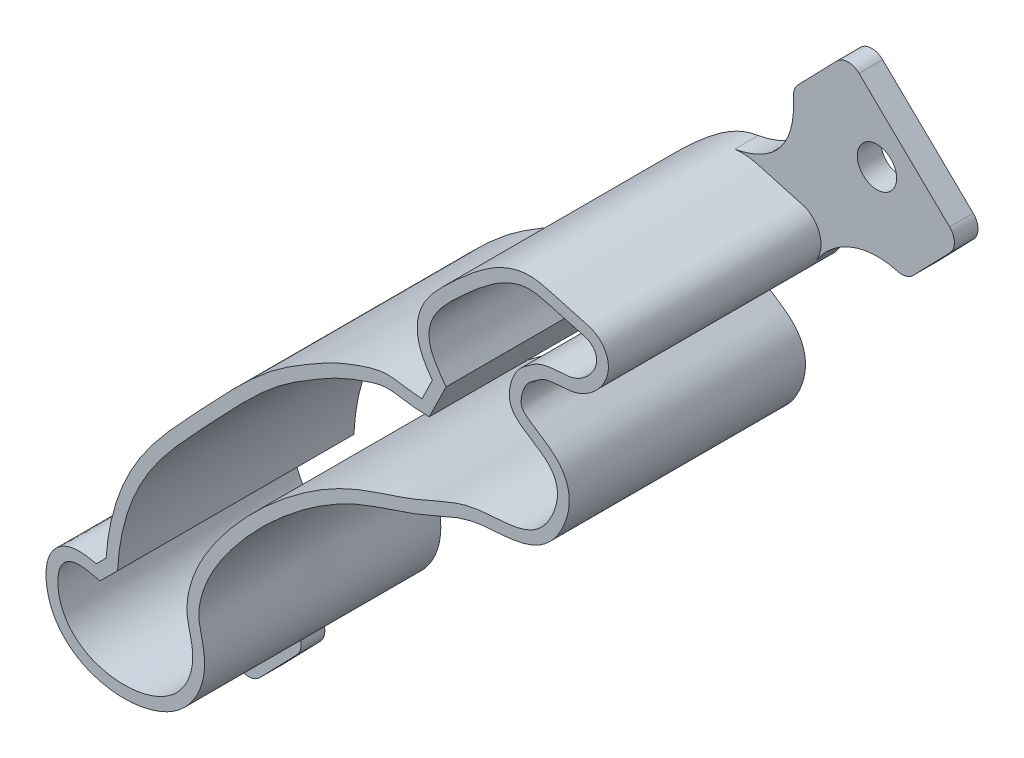
from build123d import *

# Parameters (mm, degrees)
AUFSATZ_LINEAR_AUSTRAGEN1_DEPTH = 30
SKIZZE4_R                       = 2.5
AUFSATZ_LINEAR_AUSTRAGEN2_DEPTH = 3
VERRUNDUNG2_R                   = 2


with BuildPart() as part:
    # Skizze1 → Aufsatz-Linear austragen1 (new body)
    with BuildSketch(Plane.XY):
        with BuildLine():
            Line((42.684745175, 107.096993324), (41.368199668, 104.408447166))
            add(Edge.make_bspline(
                [(41.368199668, 104.408447166), (41.110444786, 104.420789515), (40.571909189, 104.459226297), (39.686790245, 104.558252616), (38.839336683, 104.696831836), (37.785412304, 104.87433639), (36.403984322, 104.903282846), (34.890938306, 104.578423384), (33.494701301, 104.108622874), (32.300077498, 103.674851105), (30.87069998, 103.094466137), (29.377511181, 102.385227444), (27.924342025, 101.572360027), (26.668213716, 100.837909596), (24.921268561, 99.788883681), (22.676632693, 98.298620113), (19.753153503, 95.853589631), (16.756521908, 92.861675129), (13.870308283, 89.797541938), (11.280500902, 87.06101569), (8.925574014, 84.474859509), (6.828379984, 81.916464665), (5.011414663, 79.235661473), (3.538385102, 76.416346451), (2.599357566, 73.941292572), (2.02372332, 71.877642735), (1.679434335, 70.294523949), (1.462133561, 68.912253102), (1.330509691, 67.749644023), (1.277236276, 67.130335663), (1.254730167, 66.824976337)],
                knots=[0.067302069, 0.067302069, 0.067302069, 0.067302069, 0.069464425, 0.071626781, 0.075951494, 0.080276206, 0.084600918, 0.088925631, 0.093250343, 0.097575055, 0.101899768, 0.110549192, 0.119198617, 0.127848042, 0.136497466, 0.153796315, 0.171095165, 0.188394014, 0.205692863, 0.222991712, 0.240290562, 0.257589411, 0.27488826, 0.292187109, 0.309485959, 0.318135383, 0.326784808, 0.335434233, 0.339758945, 0.344083657, 0.344083657, 0.344083657, 0.344083657], degree=3))
            Line((1.254730167, 66.824976337), (0.017796089, 65.588042258))
            add(Edge.make_bspline(
                [(0.017796089, 65.588042258), (-0.244648213, 65.64806781), (-0.755191613, 65.756926814), (-1.629856798, 65.882438741), (-2.614690737, 65.902488558), (-3.603844624, 65.718346383), (-4.469780461, 65.294320663), (-5.265117391, 64.663740553), (-5.882578719, 63.748387396), (-6.239582178, 62.694571707), (-6.424489488, 61.374304763), (-6.320306972, 59.821598642), (-5.838699384, 58.064670176), (-5.017650332, 56.520278156), (-3.928053668, 55.233811575), (-2.649995065, 54.221218877), (-0.784150663, 53.215725841), (1.728758627, 52.536954876), (4.808293622, 52.484198335), (7.773624977, 53.126623931), (10.504152088, 54.533839182), (12.559787893, 56.785829512), (13.480238502, 58.991878403), (13.779666355, 60.83173084), (13.751039061, 62.738900333), (13.371743296, 64.239268886), (13.117064427, 65.391493969), (13.028347287, 66.036020364), (13.023518574, 66.721100206), (13.121598696, 67.704660197), (13.438509749, 69.034808789), (14.028892738, 70.62728641), (14.785894011, 72.16323496), (15.704866368, 73.686138517), (17.126331547, 75.727266174), (19.166063123, 78.234748399), (22.84359805, 82.012108664), (26.914890769, 85.268263257), (30.928485532, 87.698918859), (33.719631565, 88.991220721), (36.531413695, 89.965738513), (39.074183345, 90.7912503), (41.257237752, 91.598971181), (43.006447006, 92.349575342), (44.654504426, 93.112093696), (46.319465893, 93.766075323), (47.836974638, 94.170038313), (49.156753082, 94.367726158), (50.329679031, 94.449710982), (51.730768055, 94.532641699), (53.268067895, 94.70413148), (54.918338671, 95.09694813), (56.633188858, 95.884386862), (58.185300186, 97.322226028), (59.151259534, 98.903343484), (59.784278271, 100.47929905), (60.115229864, 102.014685415), (60.05302807, 103.66672864), (59.441536213, 105.22509509), (58.476947683, 106.416553856), (57.368278048, 107.310038504), (56.304452671, 108.001807994), (55.019721335, 108.808125922), (54.347004291, 109.379941438), (54.094317117, 109.753332202), (54.008173476, 109.964363478), (53.953029789, 110.24776581), (53.971305456, 110.787494722), (54.106436457, 111.450340423), (54.342775551, 112.099160299), (54.598074263, 112.561241013), (54.869658734, 112.89201557), (55.231700609, 113.226311081), (55.697591488, 113.571495459), (56.23748954, 113.949900249), (56.560624546, 114.146654628), (56.843540157, 114.278418914), (57.187335435, 114.386143729), (57.60447607, 114.470585282), (57.999278293, 114.528685861), (58.401125805, 114.569955012), (58.776462947, 114.597357517), (59.068514562, 114.614447581), (59.441900862, 114.629359852), (59.977725276, 114.668739075), (60.622397089, 114.76745089), (61.390581121, 114.99205063), (62.105336096, 115.334077904), (62.938449707, 115.872746083), (63.827596145, 116.690707986), (64.536292789, 117.700102022), (64.940057116, 118.741621438), (65.092514319, 119.705306675), (64.928404483, 120.881660275), (64.246562877, 122.029666883), (63.256137541, 122.774829518), (62.202024178, 123.115493857), (61.802040186, 123.194059258), (61.41431502, 123.29737748), (61.047982241, 123.394160641), (60.539356847, 123.535818691), (59.957270455, 123.702322368), (59.220811129, 123.910609773), (58.57483209, 124.090877152), (57.934449819, 124.26525543), (57.366827181, 124.419678095), (56.638996122, 124.605724945), (55.708700262, 124.781939863), (54.580399979, 124.781955193), (53.519531216, 124.645437169), (52.280840664, 124.284255555), (50.483658808, 123.442733168), (48.487135329, 122.076217429), (46.397465294, 120.283391136), (44.65504561, 118.698758406), (43.096740441, 117.149873286), (41.798273751, 115.510572973), (40.84344516, 113.539688645), (40.683235015, 111.544530592), (41.046321185, 109.993839809), (41.525042222, 108.894111465), (42.092878422, 107.945562788), (42.482020559, 107.381105246), (42.684745175, 107.096993324)],
                knots=[0.379779857, 0.379779857, 0.379779857, 0.379779857, 0.382366781, 0.384953706, 0.387540631, 0.390127555, 0.391421018, 0.39271448, 0.395301405, 0.397888329, 0.400475254, 0.405649103, 0.410822953, 0.415996802, 0.421170651, 0.426344501, 0.43151835, 0.441866049, 0.452213747, 0.462561446, 0.472909145, 0.483256843, 0.493604542, 0.498778391, 0.503952241, 0.51429994, 0.519473789, 0.524647638, 0.529821488, 0.534995337, 0.545343036, 0.555690734, 0.566038433, 0.576386132, 0.58673383, 0.607429228, 0.628124625, 0.66951542, 0.690210817, 0.710906215, 0.731601612, 0.752297009, 0.762644708, 0.772992407, 0.783340105, 0.793687804, 0.804035503, 0.809209352, 0.814383201, 0.819557051, 0.8247309, 0.829904749, 0.835078599, 0.840252448, 0.845426297, 0.850600147, 0.855773996, 0.860947845, 0.866121695, 0.871295544, 0.876469394, 0.881643243, 0.886817092, 0.897164791, 0.90233864, 0.90751249, 0.912686339, 0.917860188, 0.923034038, 0.928207887, 0.933381736, 0.938555586, 0.943729435, 0.948903284, 0.954077134, 0.959250983, 0.964424832, 0.969598682, 0.972185606, 0.974772531, 0.977359456, 0.978652918, 0.97994638, 0.981239843, 0.982533305, 0.983826767, 0.98512023, 0.986413692, 0.987707154, 0.990294079, 0.992881004, 0.994174466, 0.995467928, 0.996761391, 0.998054853, 0.999348315, 1.000641778, 1.00193524, 1.003228702, 1.004522165, 1.005815627, 1.008402552, 1.009696014, 1.010989476, 1.012282939, 1.01292967, 1.013576401, 1.014869863, 1.015516595, 1.016163326, 1.017456788, 1.01875025, 1.021337175, 1.0239241, 1.026511024, 1.029097949, 1.031684874, 1.034271798, 1.036858723, 1.038152185, 1.039445648, 1.04073911, 1.042032572, 1.042032572, 1.042032572, 1.042032572], degree=3))
        make_face()
        with BuildLine():
            Line((2.713993648, 66.162919474), (0.484654176, 63.933580002))
            add(Edge.make_bspline(
                [(0.484654176, 63.933580002), (0.253263155, 63.989917411), (-0.20310586, 64.10277936), (-0.928264296, 64.262174214), (-1.659819911, 64.375207673), (-2.4052683, 64.400470538), (-3.176793025, 64.282768573), (-3.974007098, 63.841524196), (-4.480043894, 63.160306525), (-4.839881466, 62.191707314), (-4.926028446, 60.913305611), (-4.683365147, 59.378180969), (-4.15296127, 58.011813799), (-3.112444543, 56.458644628), (-1.317615736, 55.049913147), (1.255634286, 54.151228593), (3.994870157, 53.941056702), (6.675619947, 54.369603729), (9.09316757, 55.416433115), (10.957480442, 57.149304567), (12.046226709, 59.28673041), (12.392927964, 61.639074156), (11.950340135, 63.826901506), (11.499361431, 65.612877911), (11.522084065, 67.320114396), (11.900861519, 69.146684512), (12.519594634, 70.915083401), (13.579156452, 73.162100832), (15.31840406, 75.857449843), (17.843885599, 79.00893442), (21.637363773, 82.95222755), (25.852930285, 86.359488578), (30.055971766, 88.936875694), (33.047709454, 90.343008328), (35.966044833, 91.359528175), (38.492553414, 92.178114336), (40.619151295, 92.96053252), (42.849828387, 93.91045646), (45.102841925, 94.987442181), (47.453249293, 95.625868479), (48.94404156, 95.85501786), (50.607360236, 95.975077751), (52.504807383, 96.069135239), (54.399453085, 96.514720711), (55.77366875, 97.143627953), (56.974241462, 98.239105212), (57.801121418, 99.568279872), (58.346446917, 100.929275411), (58.608797798, 102.177490683), (58.552984169, 103.374847162), (57.979159061, 104.8272633), (56.533049687, 106.138129977), (54.391114039, 107.384994724), (53.032280722, 108.508958692), (52.572073155, 109.379464256), (52.440746341, 110.239884883), (52.502585389, 111.328195888), (52.956886432, 112.858694842), (53.666027779, 113.841806753), (54.348034429, 114.44244064), (54.906196091, 114.848749274), (55.443190401, 115.224487638), (55.895740046, 115.497065146), (56.387216582, 115.715356581), (57.032791097, 115.89948856), (57.778612258, 116.018679257), (58.55024576, 116.088660341), (59.188416584, 116.121507176), (60.091464406, 116.162881051), (61.213714452, 116.511305837), (62.158347409, 117.163275088), (62.931624049, 117.980572616), (63.385916678, 118.782220104), (63.558480064, 119.536201411), (63.530815929, 120.176095369), (63.242831353, 120.829126537), (62.72818533, 121.320476283), (62.053468601, 121.606231684), (61.542247555, 121.71401868), (61.144060032, 121.817600887), (60.621194197, 121.954476895), (59.970957326, 122.138068059), (59.159465728, 122.369710296), (58.331731387, 122.601983546), (57.598483071, 122.801404065), (56.735674609, 123.041336248), (55.611916938, 123.29208297), (54.299444185, 123.281571056), (53.062728758, 122.96596196), (51.870751713, 122.450324362), (50.346976007, 121.561036036), (48.551598983, 120.186174868), (46.645088357, 118.48239858), (45.010154709, 116.967397012), (43.665875677, 115.50862865), (42.676879414, 114.016399813), (42.166905351, 112.347343859), (42.356608433, 110.548854725), (43.275426421, 108.81090802), (44.04532567, 107.770718234), (44.429602308, 107.249472738)],
                knots=[0.376785914, 0.376785914, 0.376785914, 0.376785914, 0.379389225, 0.381992537, 0.384595848, 0.387199159, 0.389802471, 0.392405782, 0.395009093, 0.397612405, 0.402819027, 0.40802565, 0.413232273, 0.418438896, 0.428852141, 0.439265387, 0.449678632, 0.460091877, 0.470505123, 0.480918368, 0.491331614, 0.501744859, 0.512158105, 0.52257135, 0.532984596, 0.543397841, 0.553811087, 0.564224332, 0.585050823, 0.605877314, 0.626703805, 0.668356787, 0.689183278, 0.710009768, 0.730836259, 0.75166275, 0.762075996, 0.772489241, 0.793315732, 0.803728978, 0.8089356, 0.814142223, 0.824555468, 0.829762091, 0.834968714, 0.840175337, 0.845381959, 0.850588582, 0.855795205, 0.861001828, 0.86620845, 0.876621696, 0.887034941, 0.897448187, 0.907861432, 0.913068055, 0.918274678, 0.928687923, 0.939101168, 0.944307791, 0.949514414, 0.954721037, 0.959927659, 0.965134282, 0.970340905, 0.975547528, 0.978150839, 0.98075415, 0.983357462, 0.985960773, 0.988564084, 0.991167396, 0.993770707, 0.995072363, 0.996374019, 0.997675674, 0.99897733, 1.000278986, 1.001580641, 1.002882297, 1.004183953, 1.006787264, 1.009390575, 1.010692231, 1.011993887, 1.013295542, 1.014597198, 1.015898854, 1.017200509, 1.018502165, 1.019803821, 1.022407132, 1.025010444, 1.027613755, 1.030217066, 1.032820378, 1.035423689, 1.038027, 1.040630312, 1.043233623, 1.043233623, 1.043233623, 1.043233623], degree=3))
            Line((44.429602308, 107.249472738), (42.295183389, 102.890729533))
            add(Edge.make_bspline(
                [(42.295183389, 102.890729533), (41.988977141, 102.887290354), (41.365471762, 102.899548905), (40.207822995, 102.979643738), (39.088362681, 103.129263726), (38.097312109, 103.308117577), (37.085633154, 103.416404897), (35.939612562, 103.302881249), (34.568491884, 102.89425574), (33.308787507, 102.450591021), (31.855491223, 101.887464338), (30.353068834, 101.199546083), (28.899544564, 100.404899444), (27.616192517, 99.654347791), (25.886110449, 98.623784194), (23.701874568, 97.188537865), (20.873654736, 94.847671904), (17.872855748, 91.859987913), (13.971502129, 87.715573796), (10.64685561, 84.222370354), (7.910296022, 80.859172122), (6.178076783, 78.259414328), (4.790726243, 75.536543302), (3.919196999, 73.14815839), (3.392093598, 71.150306786), (3.081104421, 69.612954132), (2.889813355, 68.25413917), (2.776880215, 67.096715668), (2.732286744, 66.47046256), (2.713993648, 66.162919474)],
                knots=[0.064903234, 0.064903234, 0.064903234, 0.064903234, 0.067104686, 0.069306138, 0.073709041, 0.078111944, 0.082514847, 0.08691775, 0.091320653, 0.095723556, 0.100126459, 0.108932266, 0.117738072, 0.126543878, 0.135349684, 0.152961297, 0.170572909, 0.188184522, 0.205796134, 0.241019359, 0.258630972, 0.276242585, 0.293854197, 0.31146581, 0.320271616, 0.329077422, 0.337883228, 0.342286131, 0.346689035, 0.346689035, 0.346689035, 0.346689035], degree=3))
        make_face(mode=Mode.SUBTRACT)
    extrude(amount=AUFSATZ_LINEAR_AUSTRAGEN1_DEPTH)

    # Skizze4 → Aufsatz-Linear austragen2 (add)
    # profile 1 of 2: a face of its own
    with BuildSketch(Plane.XY):
        with BuildLine():
            add(Edge.make_bspline(
                [(-15.02502366, 56.111273957), (-8.267135558, 52.58443691), (-6.365925149, 60.791212107)],
                knots=[0, 0, 0, 1, 1, 1], degree=2))
            Line((-15.02502366, 56.111273957), (-21.980066044, 48.926054028))
            Line((-21.980066044, 48.926054028), (-7.609626184, 35.01596926))
            Line((-7.609626184, 35.01596926), (-0.6545838, 42.201189189))
            add(Edge.make_bspline(
                [(-0.6545838, 42.201189189), (-4.002038628, 50.109902388), (5.581588134, 52.702137361)],
                knots=[0, 0, 0, 1, 1, 1], degree=2))
            add(Edge.make_bspline(
                [(-6.365925149, 60.791212107), (-6.349586324, 60.468403195), (-6.242829933, 59.538958545), (-5.838699384, 58.064670176), (-5.017650332, 56.520278156), (-3.928053668, 55.233811575), (-2.649995065, 54.221218877), (-0.784150663, 53.215725841), (1.728758627, 52.536954876), (4.052353579, 52.497148596), (5.319046451, 52.659920833), (5.581588134, 52.702137361)],
                knots=[0.402972232, 0.402972232, 0.402972232, 0.402972232, 0.405649103, 0.410822953, 0.415996802, 0.421170651, 0.426344501, 0.43151835, 0.441866049, 0.452213747, 0.454941231, 0.454941231, 0.454941231, 0.454941231], degree=3))
        make_face()
        with Locations(Location((-11.317324922, 45.563621608, 0), (0, 0, 180))):
            Circle(SKIZZE4_R, mode=Mode.SUBTRACT)
    # profile 2 of 2: a face of its own
    with BuildSketch(Plane.XY):
        with BuildLine():
            add(Edge.make_bspline(
                [(64.458817782, 117.662403007), (64.516435563, 117.764527579), (64.692183377, 118.102225399), (64.940057116, 118.741621438), (65.092514319, 119.705306675), (64.928404483, 120.881660275), (64.246562877, 122.029666883), (63.256137541, 122.774829518), (62.202024178, 123.115493857), (61.802040186, 123.194059258), (61.41431502, 123.29737748), (61.047982241, 123.394160641), (60.539356847, 123.535818691), (59.957270455, 123.702322368), (59.220811129, 123.910609773), (58.57483209, 124.090877152), (57.934449819, 124.26525543), (57.366827181, 124.419678095), (56.638996122, 124.605724945), (55.708700262, 124.781939863), (54.677714638, 124.781953871), (54.233966356, 124.735213932), (54.061228117, 124.710619916)],
                knots=[0.992291666, 0.992291666, 0.992291666, 0.992291666, 0.992881004, 0.994174466, 0.995467928, 0.996761391, 0.998054853, 0.999348315, 1.000641778, 1.00193524, 1.003228702, 1.004522165, 1.005815627, 1.008402552, 1.009696014, 1.010989476, 1.012282939, 1.01292967, 1.013576401, 1.014869863, 1.015516595, 1.015940206, 1.015940206, 1.015940206, 1.015940206], degree=3))
            ThreePointArc((64.458817782, 117.662403007), (69.492948672, 121.559004253), (75.850882424, 121.238608414))
            Line((75.850882424, 121.238608414), (82.805924808, 128.423828344))
            Line((82.805924808, 128.423828344), (68.435484949, 142.333913112))
            Line((68.435484949, 142.333913112), (61.480442565, 135.148693183))
            add(Edge.make_bspline(
                [(61.480442565, 135.148693183), (62.396596576, 126.290236569), (54.061228117, 124.710619916)],
                knots=[0, 0, 0, 0.97338968, 0.97338968, 0.97338968], degree=2))
        make_face()
        with Locations(Location((72.143183686, 131.786260763, 0), (0, 0, 180))):
            Circle(SKIZZE4_R, mode=Mode.SUBTRACT)
    extrude(amount=AUFSATZ_LINEAR_AUSTRAGEN2_DEPTH)

    # Verrundung2
    verrundung2_edges = [part.edges().sort_by_distance(p)[0] for p in [
        (75.850882424, 121.238608414, 1.5),
        (82.805924808, 128.423828344, 1.5),
        (68.435484949, 142.333913112, 1.5),
        (-21.980066044, 48.926054028, 1.5),
        (-7.609626184, 35.01596926, 1.5),
        (-0.6545838, 42.201189189, 1.5),
        (-15.02502366, 56.111273957, 1.5),
        (61.480442565, 135.148693183, 1.5),
    ]]
    fillet(verrundung2_edges, radius=VERRUNDUNG2_R)


solid = part.part
